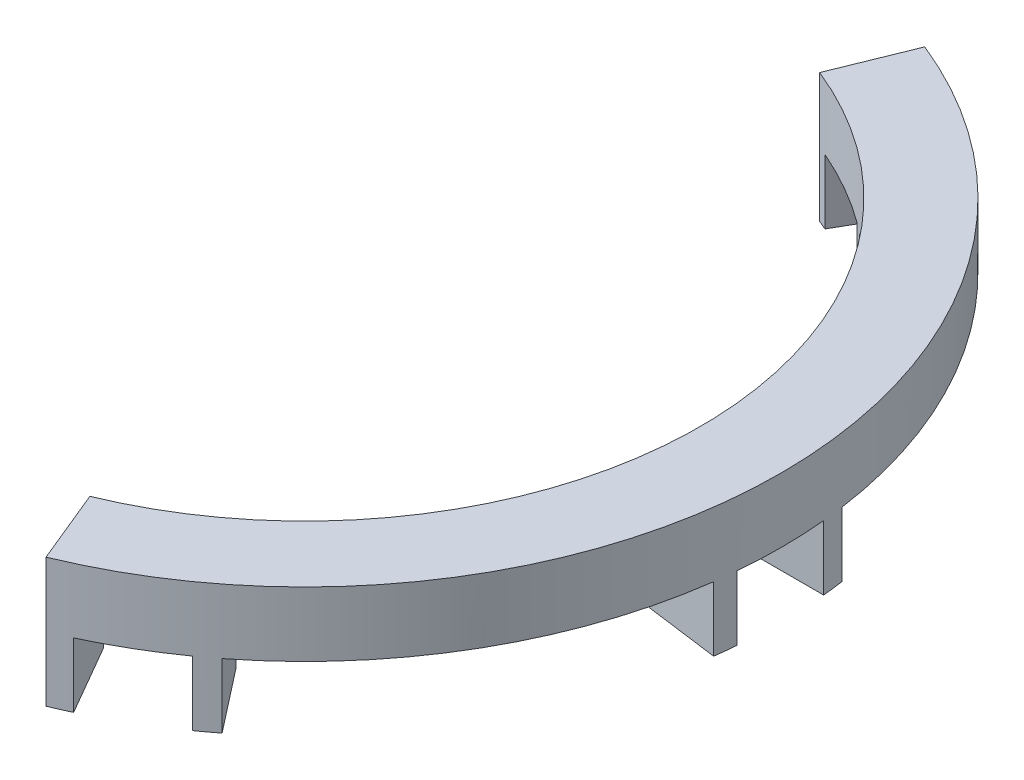
from build123d import *

# Parameters (mm, degrees)
BOSS_EXTRUDE1_DEPTH   = 8
BOSS_EXTRUDE1_2_DEPTH = 8
BOSS_EXTRUDE1_3_DEPTH = 8
BOSS_EXTRUDE1_4_DEPTH = 8
BOSS_EXTRUDE1_5_DEPTH = 8
BOSS_EXTRUDE1_6_DEPTH = 8
BOSS_EXTRUDE2_DEPTH   = 8


with BuildPart() as part:
    # Sketch1 → Boss-Extrude1 (new body)
    with BuildSketch(Plane(origin=(0, 0, 0), x_dir=(1, 0, 0), z_dir=(0, 1, 0))):
        with BuildLine():
            Line((48.53037343, 6.767780637), (58.434531273, 8.148960359))
            ThreePointArc((58.434531273, 8.148960359), (58.599760274, 6.860619197), (58.736587944, 5.568952925))
            Line((58.736587944, 5.568952925), (48.68250983, 5.568952925))
            ThreePointArc((48.68250983, 5.568952925), (48.61013747, 6.168835799), (48.53037343, 6.767780637))
        make_face()
    extrude(amount=BOSS_EXTRUDE1_DEPTH)



with BuildPart() as body_2:
    # Sketch1 → Boss-Extrude1 2 (new body)
    with BuildSketch(Plane(origin=(0, 0, 0), x_dir=(1, 0, 0), z_dir=(0, 1, 0))):
        with BuildLine():
            Line((18.404116756, 45.412426564), (22.160058951, 54.68026872))
            ThreePointArc((22.160058951, 54.68026872), (23.358409627, 54.179190652), (24.545439267, 53.651853754))
            Line((24.545439267, 53.651853754), (19.518400209, 44.944766695))
            ThreePointArc((19.518400209, 44.944766695), (18.962700221, 45.18203183), (18.404116756, 45.412426564))
        make_face()
    extrude(amount=BOSS_EXTRUDE1_2_DEPTH)


with BuildPart() as body_3:
    # Sketch1 → Boss-Extrude1 3 (new body)
    with BuildSketch(Plane(origin=(0, 0, 0), x_dir=(1, 0, 0), z_dir=(0, 1, 0))):
        with BuildLine():
            Line((29.904437191, 38.816551061), (36.007383557, 46.738296175))
            ThreePointArc((36.007383557, 46.738296175), (34.969196448, 47.520051555), (33.914042358, 48.278750304))
            Line((33.914042358, 48.278750304), (28.890208092, 39.577214106))
            ThreePointArc((28.890208092, 39.577214106), (29.399782832, 39.200162875), (29.904437191, 38.816551061))
        make_face()
    extrude(amount=BOSS_EXTRUDE1_3_DEPTH)


with BuildPart() as body_4:
    # Sketch1 → Boss-Extrude1 4 (new body)
    with BuildSketch(Plane(origin=(0, 0, 0), x_dir=(1, 0, 0), z_dir=(0, 1, 0))):
        with BuildLine():
            Line((48.568337902, -6.489726763), (58.480243596, -7.814160796))
            ThreePointArc((58.480243596, -7.814160796), (58.63817006, -6.524186697), (58.767645405, -5.231047075))
            Line((58.767645405, -5.231047075), (48.719976873, -5.231047075))
            ThreePointArc((48.719976873, -5.231047075), (48.648228298, -5.860877361), (48.568337902, -6.489726763))
        make_face()
    extrude(amount=BOSS_EXTRUDE1_4_DEPTH)


with BuildPart() as body_5:
    # Sketch1 → Boss-Extrude1 5 (new body)
    with BuildSketch(Plane(origin=(0, 0, 0), x_dir=(1, 0, 0), z_dir=(0, 1, 0))):
        with BuildLine():
            Line((30.126256674, -38.644645927), (36.274472321, -46.531308361))
            ThreePointArc((36.274472321, -46.531308361), (35.241350648, -47.318571455), (34.191148678, -48.082900829))
            Line((34.191148678, -48.082900829), (29.16410962, -39.37581377))
            ThreePointArc((29.16410962, -39.37581377), (29.647437249, -39.013196031), (30.126256674, -38.644645927))
        make_face()
    extrude(amount=BOSS_EXTRUDE1_5_DEPTH)


with BuildPart() as body_6:
    # Sketch1 → Boss-Extrude1 6 (new body)
    with BuildSketch(Plane(origin=(0, 0, 0), x_dir=(1, 0, 0), z_dir=(0, 1, 0))):
        with BuildLine():
            Line((18.66390071, -45.306277824), (22.472860039, -54.552456972))
            ThreePointArc((22.472860039, -54.552456972), (23.668973612, -54.044238251), (24.853603047, -53.509797379))
            Line((24.853603047, -53.509797379), (19.829768781, -44.808261181))
            ThreePointArc((19.829768781, -44.808261181), (19.248445466, -45.061040236), (18.66390071, -45.306277824))
        make_face()
    extrude(amount=BOSS_EXTRUDE1_6_DEPTH)


with BuildPart() as part_1:
    add(part.part)

    add(body_2.part)  # Boss-Extrude2 merges body 2

    add(body_3.part)  # Boss-Extrude2 merges body 3

    add(body_4.part)  # Boss-Extrude2 merges body 4

    add(body_5.part)  # Boss-Extrude2 merges body 5

    add(body_6.part)  # Boss-Extrude2 merges body 6
    # Sketch2 → Boss-Extrude2 (add)
    with BuildSketch(Plane(origin=(0, 8, 0), x_dir=(1, 0, 0), z_dir=(0, 1, 0))):
        with BuildLine():
            Line((22.160058951, 54.68026872), (18.404116756, 45.412426564))
            ThreePointArc((18.404116756, 45.412426564), (48.999799093, 0.140316836), (18.66390071, -45.306277824))
            Line((18.66390071, -45.306277824), (22.472860039, -54.552456972))
            ThreePointArc((22.472860039, -54.552456972), (58.999758092, 0.168952925), (22.160058951, 54.68026872))
        make_face()
    extrude(amount=BOSS_EXTRUDE2_DEPTH)


solid = part_1.part
